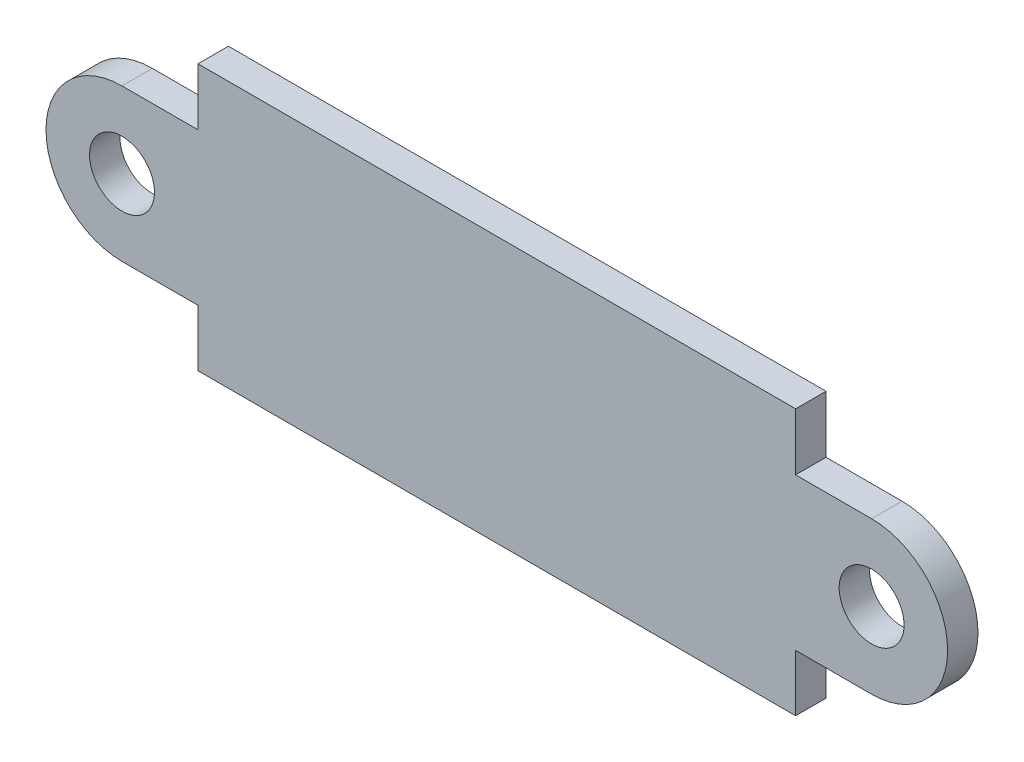
from build123d import *

# Parameters (mm, degrees)
SKETCH1_R           = 1.6002
BOSS_EXTRUDE1_DEPTH = 1.4986


with BuildPart() as part:
    # Sketch1 → Boss-Extrude1 (new body)
    with BuildSketch(Plane.XY):
        with BuildLine():
            Line((0, 0), (29.464, 0))
            Line((29.464, 0), (29.464, -2.8194))
            Line((29.464, -2.8194), (33.2105, -2.8194))
            ThreePointArc((33.2105, -2.8194), (36.957, -6.5659), (33.2105, -10.3124))
            Line((33.2105, -10.3124), (29.464, -10.3124))
            Line((29.464, -10.3124), (29.464, -13.1064))
            Line((29.464, -13.1064), (0, -13.1064))
            Line((0, -13.1064), (0, -10.3124))
            Line((0, -10.3124), (-3.7465, -10.3124))
            ThreePointArc((-3.7465, -10.3124), (-7.493, -6.5659), (-3.7465, -2.8194))
            Line((-3.7465, -2.8194), (0, -2.8194))
            Line((0, -2.8194), (0, 0))
        make_face()
        with Locations((-3.7465, -6.5659)):
            Circle(SKETCH1_R, mode=Mode.SUBTRACT)
        with Locations((33.2105, -6.5659)):
            Circle(SKETCH1_R, mode=Mode.SUBTRACT)
    extrude(amount=-BOSS_EXTRUDE1_DEPTH)


solid = part.part
